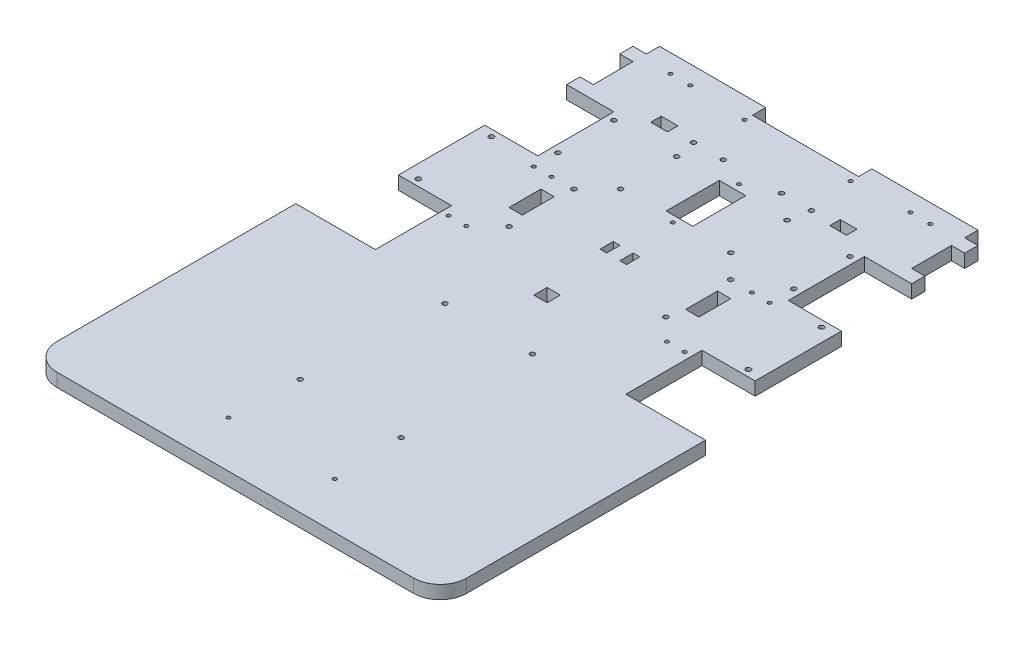
from build123d import *
from build123d.topology import SkipClean

# Parameters (mm, degrees)
SKETCH1_R           = 0.889
SKETCH1_R_2         = 1.1303
SKETCH1_W           = 6.35
SKETCH1_H           = 15.24
SKETCH1_W_2         = 3.175
SKETCH1_H_2         = 6.35
SKETCH1_W_3         = 8.000000002
SKETCH1_H_3         = 5
BOSS_EXTRUDE1_DEPTH = 6.35
SKETCH2_R           = 1.1684
CUT_EXTRUDE1_DEPTH  = 6.35


with BuildPart() as part:
    # Sketch1 → Boss-Extrude1 (new body)
    with BuildSketch(Plane(origin=(0, 0, 0), x_dir=(1, 0, 0), z_dir=(0, 1, 0))):
        with BuildLine():
            Line((-147.642205972, 18.314662121), (-147.642205972, -22.960337879))
            Line((-147.642205972, -22.960337879), (-122.242205972, -22.960337879))
            Line((-122.242205972, -22.960337879), (-122.242205972, -59.409337879))
            Line((-122.242205972, -59.409337879), (-147.642205972, -59.409337879))
            Line((-147.642205972, -59.409337879), (-160.342205972, -59.409337879))
            Line((-160.342205972, -59.409337879), (-160.342205972, -72.109337879))
            Line((-160.342205972, -72.109337879), (-160.342205972, -173.709337879))
            ThreePointArc((-160.342205972, -173.709337879), (-156.622462093, -182.689594), (-147.642205972, -186.409337879))
            Line((-147.642205972, -186.409337879), (-62.292205972, -186.409337879))
            Line((-62.292205972, -186.409337879), (-62.292205972, -40.359337879))
            Line((-62.292205972, -40.359337879), (-65.467205972, -40.359337879))
            Line((-65.467205972, -40.359337879), (-65.467205972, -34.009337879))
            Line((-65.467205972, -34.009337879), (-62.292205972, -34.009337879))
            Line((-62.292205972, -34.009337879), (-62.292205972, 22.124662121))
            ThreePointArc((-62.292205972, 22.124662121), (-63.181205972, 23.013662121), (-62.292205972, 23.902662121))
            Line((-62.292205972, 23.902662121), (-62.292205972, 26.188662121))
            Line((-62.292205972, 26.188662121), (-68.642205972, 26.188662121))
            Line((-68.642205972, 26.188662121), (-68.642205972, 51.588662121))
            Line((-68.642205972, 51.588662121), (-62.292205972, 51.588662121))
            Line((-62.292205972, 51.588662121), (-62.292205972, 53.874662121))
            ThreePointArc((-62.292205972, 53.874662121), (-63.181205972, 54.763662121), (-62.292205972, 55.652662121))
            Line((-62.292205972, 55.652662121), (-62.292205972, 86.513662121))
            Line((-62.292205972, 86.513662121), (-87.692205972, 86.513662121))
            Line((-87.692205972, 86.513662121), (-87.692205972, 92.863662121))
            Line((-87.692205972, 92.863662121), (-138.492205972, 92.863662121))
            Line((-138.492205972, 92.863662121), (-138.492205972, 86.513662121))
            Line((-138.492205972, 86.513662121), (-144.842205972, 86.513662121))
            Line((-144.842205972, 86.513662121), (-144.842205972, 80.163662121))
            Line((-144.842205972, 80.163662121), (-138.492205972, 80.163662121))
            Line((-138.492205972, 80.163662121), (-138.492205972, 61.113662121))
            Line((-138.492205972, 61.113662121), (-144.842205972, 61.113662121))
            Line((-144.842205972, 61.113662121), (-144.842205972, 54.763662121))
            Line((-144.842205972, 54.763662121), (-122.242205972, 54.763662121))
            Line((-122.242205972, 54.763662121), (-122.242205972, 18.314662121))
            Line((-122.242205972, 18.314662121), (-147.642205972, 18.314662121))
        make_face()
        with Locations((-118.749705972, -27.815337973)):
            Circle(SKETCH1_R, mode=Mode.SUBTRACT)
        with Locations((-118.749705972, 12.919662091)):
            Circle(SKETCH1_R, mode=Mode.SUBTRACT)
        with Locations((-110.264705924, 12.919662091)):
            Circle(SKETCH1_R, mode=Mode.SUBTRACT)
        with Locations((-110.264705924, -27.815337973)):
            Circle(SKETCH1_R, mode=Mode.SUBTRACT)
        with Locations((-118.749705972, 51.271162121)):
            Circle(SKETCH1_R_2, mode=Mode.SUBTRACT)
        with Locations((-118.749705972, 24.397962121)):
            Circle(SKETCH1_R_2, mode=Mode.SUBTRACT)
        with Locations((-88.701505972, 51.271162121)):
            Circle(SKETCH1_R_2, mode=Mode.SUBTRACT)
        with Locations((-88.701505972, 24.397962121)):
            Circle(SKETCH1_R_2, mode=Mode.SUBTRACT)
        with Locations((-99.792205972, 13.177162121)):
            Circle(SKETCH1_R_2, mode=Mode.SUBTRACT)
        with Locations((-99.792205972, -17.822837879)):
            Circle(SKETCH1_R_2, mode=Mode.SUBTRACT)
        with Locations((-83.247205972, -65.124337879)):
            Circle(SKETCH1_R_2, mode=Mode.SUBTRACT)
        with Locations((-86.422205972, -131.164337879)):
            Circle(SKETCH1_R_2, mode=Mode.SUBTRACT)
        with Locations((-87.692205972, -164.184337879)):
            Circle(SKETCH1_R, mode=Mode.SUBTRACT)
        with Locations((-124.497206022, 84.048662225)):
            Circle(SKETCH1_R, mode=Mode.SUBTRACT)
        with Locations((-87.692205972, 82.703662121)):
            Circle(SKETCH1_R, mode=Mode.SUBTRACT)
        with Locations((-90.492205972, 61.113662121)):
            Circle(SKETCH1_R_2, mode=Mode.SUBTRACT)
        with Locations((-76.204705972, 61.113662121)):
            Circle(SKETCH1_R_2, mode=Mode.SUBTRACT)
        with Locations((-114.972206022, 84.048662225)):
            Circle(SKETCH1_R, mode=Mode.SUBTRACT)
        with Locations((-104.549705924, -2.322837879)):
            Rectangle(SKETCH1_W, SKETCH1_H, mode=Mode.SUBTRACT)
        with Locations((-67.054705972, -2.322837879)):
            Rectangle(SKETCH1_W_2, SKETCH1_H_2, mode=Mode.SUBTRACT)
        with Locations((-105.142205973, 61.788662121)):
            Rectangle(SKETCH1_W_3, SKETCH1_H_3, mode=Mode.SUBTRACT)
    boss_extrude1 = extrude(amount=BOSS_EXTRUDE1_DEPTH)

    # Sketch2 → Cut-Extrude1 (cut)
    with BuildSketch(Plane(origin=(0, 6.35, 0), x_dir=(1, 0, 0), z_dir=(0, 1, 0))):
        with Locations((-141.292205972, 15.177162121)):
            Circle(SKETCH2_R)
        with Locations((-141.292205972, -19.822837879)):
            Circle(SKETCH2_R)
    cut_extrude1 = extrude(amount=-CUT_EXTRUDE1_DEPTH, mode=Mode.SUBTRACT)

    # Mirror1: Boss-Extrude1, Cut-Extrude1 across plane
    with SkipClean():  # the faces are left unmerged after this step: merging them gives an invalid solid
        add(boss_extrude1.mirror(Plane(origin=(-62.292205972, 6.35, -86.513662121), x_dir=(0, 0, 1), z_dir=(-1, 0, 0))))
        add(cut_extrude1.mirror(Plane(origin=(-62.292205972, 6.35, -86.513662121), x_dir=(0, 0, 1), z_dir=(-1, 0, 0))), mode=Mode.SUBTRACT)


solid = part.part
